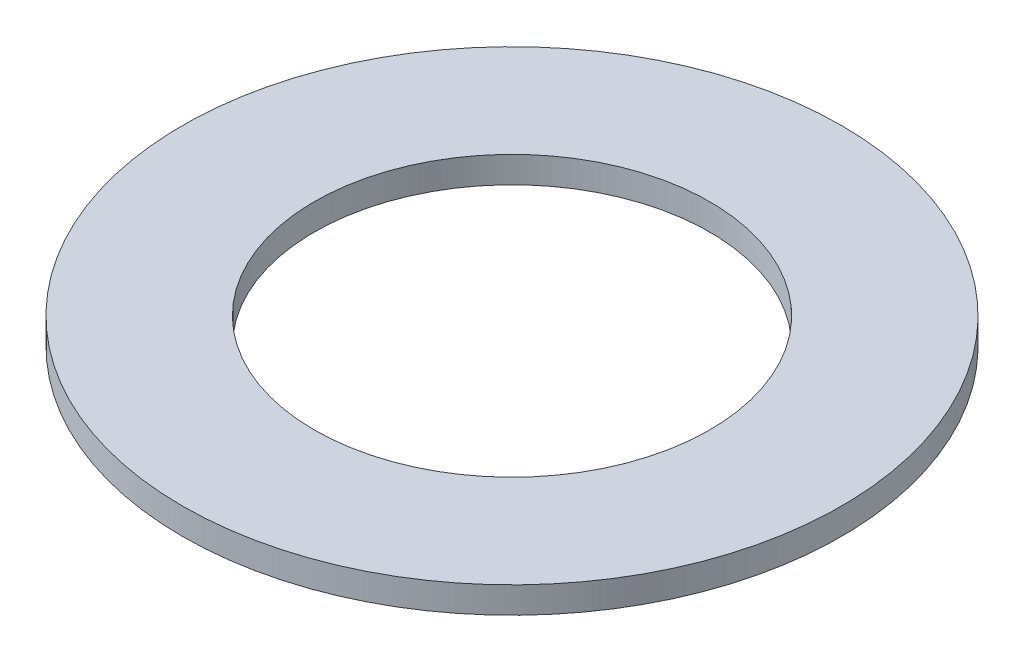
from build123d import *

# Parameters (mm, degrees)
SKETCH1_R           = 75
BOSS_EXTRUDE1_DEPTH = 6
SKETCH2_R           = 45
CUT_EXTRUDE1_DEPTH  = 107.235587258


with BuildPart() as part:
    # Sketch1 → Boss-Extrude1 (new body)
    with BuildSketch(Plane(origin=(0, 0, 0), x_dir=(1, 0, 0), z_dir=(0, 1, 0))):
        Circle(SKETCH1_R)
    extrude(amount=BOSS_EXTRUDE1_DEPTH)

    # Sketch2 → Cut-Extrude1 (cut, through all)
    with BuildSketch(Plane(origin=(0, 0, 0), x_dir=(1, 0, 0), z_dir=(0, 1, 0))):
        Circle(SKETCH2_R)
    extrude(amount=CUT_EXTRUDE1_DEPTH, mode=Mode.SUBTRACT)


solid = part.part
